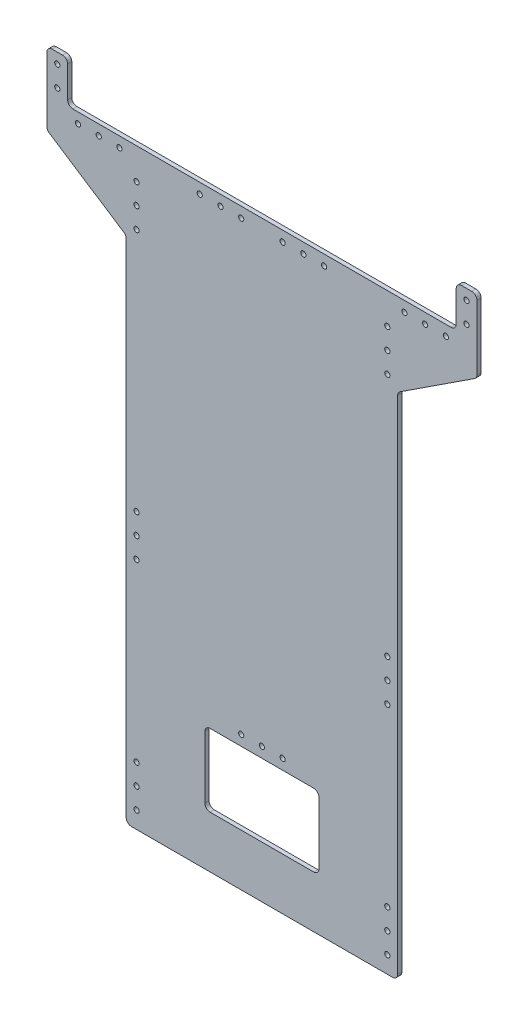
from build123d import *

# Parameters (mm, degrees)
SKETCH1_R           = 2.5
SKETCH1_W           = 110
SKETCH1_H           = 70
BOSS_EXTRUDE1_DEPTH = 4
FILLET1_R           = 5


with BuildPart() as part:
    # Sketch1 → Boss-Extrude1 (new body)
    with BuildSketch(Plane.XY):
        Polygon((131, 0), (131, 491.5), (207.5, 541.5), (207.5, 611.5), (187.5, 611.5), (187.5, 571.5), (-187.5, 571.5), (-187.5, 611.5), (-207.5, 611.5), (-207.5, 541.5), (-131, 491.5), (-131, 0), align=None)
        with Locations((-121, 16.345897877)):
            Circle(SKETCH1_R, mode=Mode.SUBTRACT)
        with Locations((-121, 36.345897877)):
            Circle(SKETCH1_R, mode=Mode.SUBTRACT)
        with Locations((-121, 56.345897877)):
            Circle(SKETCH1_R, mode=Mode.SUBTRACT)
        with Locations((-20, 130)):
            Circle(SKETCH1_R, mode=Mode.SUBTRACT)
        with Locations((-121, 225.75)):
            Circle(SKETCH1_R, mode=Mode.SUBTRACT)
        with Locations((-121, 245.75)):
            Circle(SKETCH1_R, mode=Mode.SUBTRACT)
        with Locations((-121, 265.75)):
            Circle(SKETCH1_R, mode=Mode.SUBTRACT)
        with Locations((0, 85)):
            Rectangle(SKETCH1_W, SKETCH1_H, mode=Mode.SUBTRACT)
        with Locations((0, 130)):
            Circle(SKETCH1_R, mode=Mode.SUBTRACT)
        with Locations((20, 130)):
            Circle(SKETCH1_R, mode=Mode.SUBTRACT)
        with Locations((121, 16.345897877)):
            Circle(SKETCH1_R, mode=Mode.SUBTRACT)
        with Locations((121, 36.345897877)):
            Circle(SKETCH1_R, mode=Mode.SUBTRACT)
        with Locations((121, 56.345897877)):
            Circle(SKETCH1_R, mode=Mode.SUBTRACT)
        with Locations((121, 225.75)):
            Circle(SKETCH1_R, mode=Mode.SUBTRACT)
        with Locations((121, 245.75)):
            Circle(SKETCH1_R, mode=Mode.SUBTRACT)
        with Locations((121, 265.75)):
            Circle(SKETCH1_R, mode=Mode.SUBTRACT)
        with Locations((-121, 501.5)):
            Circle(SKETCH1_R, mode=Mode.SUBTRACT)
        with Locations((-121, 521.5)):
            Circle(SKETCH1_R, mode=Mode.SUBTRACT)
        with Locations((-177.5, 561.5)):
            Circle(SKETCH1_R, mode=Mode.SUBTRACT)
        with Locations((-157.5, 561.5)):
            Circle(SKETCH1_R, mode=Mode.SUBTRACT)
        with Locations((-197.5, 581.5)):
            Circle(SKETCH1_R, mode=Mode.SUBTRACT)
        with Locations((-197.5, 601.5)):
            Circle(SKETCH1_R, mode=Mode.SUBTRACT)
        with Locations((-137.5, 561.5)):
            Circle(SKETCH1_R, mode=Mode.SUBTRACT)
        with Locations((-121, 541.5)):
            Circle(SKETCH1_R, mode=Mode.SUBTRACT)
        with Locations((-60, 561.5)):
            Circle(SKETCH1_R, mode=Mode.SUBTRACT)
        with Locations((-40, 561.5)):
            Circle(SKETCH1_R, mode=Mode.SUBTRACT)
        with Locations((-20, 561.5)):
            Circle(SKETCH1_R, mode=Mode.SUBTRACT)
        with Locations((20, 561.5)):
            Circle(SKETCH1_R, mode=Mode.SUBTRACT)
        with Locations((40, 561.5)):
            Circle(SKETCH1_R, mode=Mode.SUBTRACT)
        with Locations((60, 561.5)):
            Circle(SKETCH1_R, mode=Mode.SUBTRACT)
        with Locations((121, 501.5)):
            Circle(SKETCH1_R, mode=Mode.SUBTRACT)
        with Locations((121, 521.5)):
            Circle(SKETCH1_R, mode=Mode.SUBTRACT)
        with Locations((121, 541.5)):
            Circle(SKETCH1_R, mode=Mode.SUBTRACT)
        with Locations((137.5, 561.5)):
            Circle(SKETCH1_R, mode=Mode.SUBTRACT)
        with Locations((157.5, 561.5)):
            Circle(SKETCH1_R, mode=Mode.SUBTRACT)
        with Locations((177.5, 561.5)):
            Circle(SKETCH1_R, mode=Mode.SUBTRACT)
        with Locations((197.5, 581.5)):
            Circle(SKETCH1_R, mode=Mode.SUBTRACT)
        with Locations((197.5, 601.5)):
            Circle(SKETCH1_R, mode=Mode.SUBTRACT)
    extrude(amount=-BOSS_EXTRUDE1_DEPTH)

    # Fillet1
    fillet1_edges = [part.edges().sort_by_distance(p)[0] for p in [
        (55, 120, -2),
        (55, 50, -2),
        (-55, 50, -2),
        (-55, 120, -2),
        (-187.5, 571.5, -2),
        (-187.5, 611.5, -2),
        (-207.5, 611.5, -2),
        (-207.5, 541.5, -2),
        (-131, 491.5, -2),
        (-131, 0, -2),
        (131, 0, -2),
        (131, 491.5, -2),
        (207.5, 541.5, -2),
        (187.5, 571.5, -2),
        (187.5, 611.5, -2),
        (207.5, 611.5, -2),
    ]]
    fillet(fillet1_edges, radius=FILLET1_R)


solid = part.part
